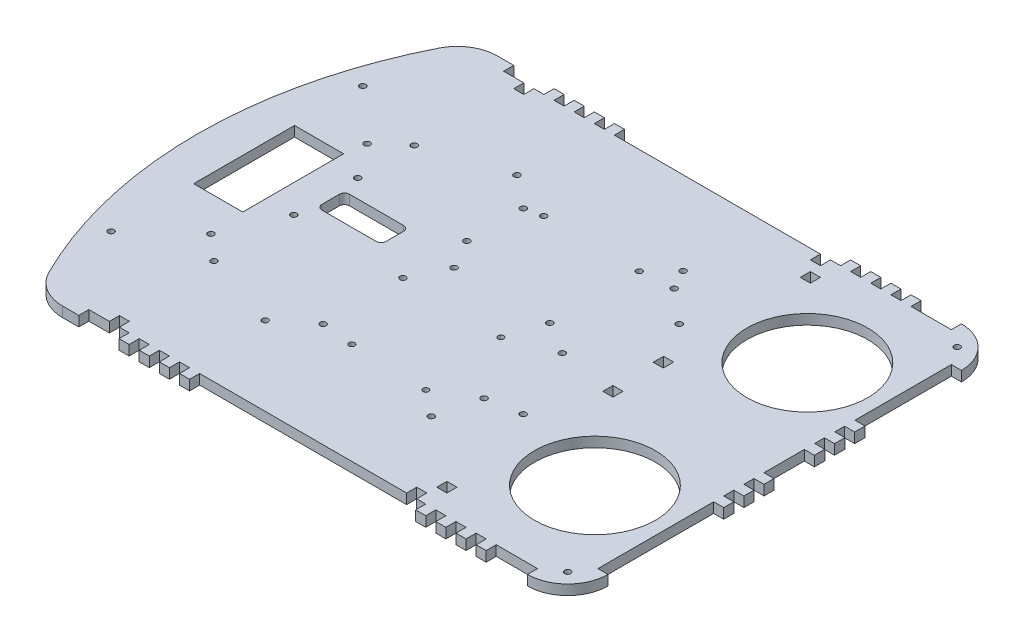
from build123d import *

# Parameters (mm, degrees)
MAIN_BASE_SKETCH_R   = 1.905
MAIN_BASE_SKETCH_R_2 = 1.796
MAIN_BASE_SKETCH_R_3 = 38.1
MAIN_BASE_SKETCH_W   = 6.302603838
MAIN_BASE_SKETCH_H   = 6.555527471
MAIN_BASE_SKETCH_W_2 = 6.35
MAIN_BASE_SKETCH_H_2 = 6.35
MAIN_BASE_SKETCH_W_3 = 30.959086934
MAIN_BASE_SKETCH_H_3 = 63.59667858
MAIN_BASE_DEPTH      = 6.35


with BuildPart() as part:
    # main_base_sketch → main_base (new body)
    with BuildSketch(Plane(origin=(0, 0, 0), x_dir=(1, 0, 0), z_dir=(0, 1, 0))):
        with BuildLine():
            Line((-94.961375831, 124.478458264), (-82.261375831, 124.478458264))
            Line((-82.261375831, 124.478458264), (-82.261375831, 118.128458264))
            Line((-82.261375831, 118.128458264), (-75.911375831, 118.128458264))
            Line((-75.911375831, 118.128458264), (-75.911375831, 124.478458264))
            Line((-75.911375831, 124.478458264), (-69.561375831, 124.478458264))
            Line((-69.561375831, 124.478458264), (-69.561375831, 130.828458264))
            Line((-69.561375831, 130.828458264), (-63.211375831, 130.828458264))
            Line((-63.211375831, 130.828458264), (-63.211375831, 124.478458264))
            Line((-63.211375831, 124.478458264), (-56.861375831, 124.478458264))
            Line((-56.861375831, 124.478458264), (-56.861375831, 130.828458264))
            Line((-56.861375831, 130.828458264), (-50.511375831, 130.828458264))
            Line((-50.511375831, 130.828458264), (-50.511375831, 124.478458264))
            Line((-50.511375831, 124.478458264), (-44.161375831, 124.478458264))
            Line((-44.161375831, 124.478458264), (-44.161375831, 130.828458264))
            Line((-44.161375831, 130.828458264), (-37.811375831, 130.828458264))
            Line((-37.811375831, 130.828458264), (-37.811375831, 124.478458264))
            Line((-37.811375831, 124.478458264), (-31.461375831, 124.478458264))
            Line((-31.461375831, 124.478458264), (-31.461375831, 130.828458264))
            Line((-31.461375831, 130.828458264), (-25.111375831, 130.828458264))
            Line((-25.111375831, 130.828458264), (-25.111375831, 124.478458264))
            Line((-25.111375831, 124.478458264), (104.775, 124.478458264))
            Line((104.775, 124.478458264), (104.775, 118.128458264))
            Line((104.775, 118.128458264), (111.125, 118.128458264))
            Line((111.125, 118.128458264), (111.125, 124.478458264))
            Line((111.125, 124.478458264), (117.475, 124.478458264))
            Line((117.475, 124.478458264), (117.475, 130.828458264))
            Line((117.475, 130.828458264), (123.825, 130.828458264))
            Line((123.825, 130.828458264), (123.825, 124.478458264))
            Line((123.825, 124.478458264), (130.175, 124.478458264))
            Line((130.175, 124.478458264), (130.175, 130.828458264))
            Line((130.175, 130.828458264), (136.525, 130.828458264))
            Line((136.525, 130.828458264), (136.525, 124.478458264))
            Line((136.525, 124.478458264), (142.875, 124.478458264))
            Line((142.875, 124.478458264), (142.875, 130.828458264))
            Line((142.875, 130.828458264), (149.225, 130.828458264))
            Line((149.225, 130.828458264), (149.225, 124.478458264))
            Line((149.225, 124.478458264), (155.575, 124.478458264))
            Line((155.575, 124.478458264), (155.575, 130.828458264))
            Line((155.575, 130.828458264), (161.925, 130.828458264))
            Line((161.925, 130.828458264), (161.925, 124.478458264))
            Line((161.925, 124.478458264), (187.325, 124.478458264))
            Line((187.325, 124.478458264), (187.325, 130.828458264))
            ThreePointArc((187.325, 130.828458264), (205.285512242, 123.388970506), (212.725, 105.428458264))
            Line((212.725, 105.428458264), (206.375, 105.428458264))
            Line((206.375, 105.428458264), (206.375, 44.655527471))
            Line((206.375, 44.655527471), (212.725, 44.655527471))
            Line((212.725, 44.655527471), (212.725, 38.1))
            Line((212.725, 38.1), (206.375, 38.1))
            Line((206.375, 38.1), (206.375, 31.955527471))
            Line((206.375, 31.955527471), (212.725, 31.955527471))
            Line((212.725, 31.955527471), (212.725, 25.4))
            Line((212.725, 25.4), (206.375, 25.4))
            Line((206.375, 25.4), (206.375, 24.179190074))
            Line((206.375, 24.179190074), (206.375, 19.255527471))
            Line((206.375, 19.255527471), (212.725, 19.255527471))
            Line((212.725, 19.255527471), (212.725, 12.7))
            Line((212.725, 12.7), (206.375, 12.7))
            Line((206.375, 12.7), (206.375, -12.7))
            Line((206.375, -12.7), (212.725, -12.7))
            Line((212.725, -12.7), (212.725, -19.05))
            Line((212.725, -19.05), (206.375, -19.05))
            Line((206.375, -19.05), (206.375, -25.4))
            Line((206.375, -25.4), (212.725, -25.4))
            Line((212.725, -25.4), (212.725, -31.75))
            Line((212.725, -31.75), (206.375, -31.75))
            Line((206.375, -31.75), (206.375, -38.1))
            Line((206.375, -38.1), (212.725, -38.1))
            Line((212.725, -38.1), (212.725, -44.45))
            Line((212.725, -44.45), (206.375, -44.45))
            Line((206.375, -44.45), (206.375, -117.410242597))
            Line((206.375, -117.410242597), (212.725, -117.410242597))
            ThreePointArc((212.725, -117.410242597), (205.285512242, -135.370754839), (187.325, -142.810242597))
            Line((187.325, -142.810242597), (187.325, -136.460242597))
            Line((187.325, -136.460242597), (161.284730748, -136.460242597))
            Line((161.284730748, -136.460242597), (161.284730748, -142.810242597))
            Line((161.284730748, -142.810242597), (154.934730748, -142.810242597))
            Line((154.934730748, -142.810242597), (154.934730748, -136.460242597))
            Line((154.934730748, -136.460242597), (148.584730748, -136.460242597))
            Line((148.584730748, -136.460242597), (148.584730748, -142.810242597))
            Line((148.584730748, -142.810242597), (142.234730748, -142.810242597))
            Line((142.234730748, -142.810242597), (142.234730748, -136.460242597))
            Line((142.234730748, -136.460242597), (135.884730748, -136.460242597))
            Line((135.884730748, -136.460242597), (135.884730748, -142.810242597))
            Line((135.884730748, -142.810242597), (129.534730748, -142.810242597))
            Line((129.534730748, -142.810242597), (129.534730748, -136.460242597))
            Line((129.534730748, -136.460242597), (123.184730748, -136.460242597))
            Line((123.184730748, -136.460242597), (123.184730748, -142.810242597))
            Line((123.184730748, -142.810242597), (116.834730748, -142.810242597))
            Line((116.834730748, -142.810242597), (116.834730748, -136.460242597))
            Line((116.834730748, -136.460242597), (111.125, -136.460242597))
            Line((111.125, -136.460242597), (111.125, -130.101785028))
            Line((111.125, -130.101785028), (104.775, -130.101785028))
            Line((104.775, -130.101785028), (104.775, -136.460242597))
            Line((104.775, -136.460242597), (-25.751645083, -136.460242597))
            Line((-25.751645083, -136.460242597), (-25.751645083, -142.810242597))
            Line((-25.751645083, -142.810242597), (-32.101645083, -142.810242597))
            Line((-32.101645083, -142.810242597), (-32.101645083, -136.460242597))
            Line((-32.101645083, -136.460242597), (-38.451645083, -136.460242597))
            Line((-38.451645083, -136.460242597), (-38.451645083, -142.810242597))
            Line((-38.451645083, -142.810242597), (-44.801645083, -142.810242597))
            Line((-44.801645083, -142.810242597), (-44.801645083, -136.460242597))
            Line((-44.801645083, -136.460242597), (-51.151645083, -136.460242597))
            Line((-51.151645083, -136.460242597), (-51.151645083, -142.810242597))
            Line((-51.151645083, -142.810242597), (-57.501645083, -142.810242597))
            Line((-57.501645083, -142.810242597), (-57.501645083, -136.460242597))
            Line((-57.501645083, -136.460242597), (-63.851645083, -136.460242597))
            Line((-63.851645083, -136.460242597), (-63.851645083, -142.810242597))
            Line((-63.851645083, -142.810242597), (-70.201645083, -142.810242597))
            Line((-70.201645083, -142.810242597), (-70.201645083, -136.460242597))
            Line((-70.201645083, -136.460242597), (-76.408932816, -136.460242597))
            Line((-76.408932816, -136.460242597), (-76.408932816, -130.101785028))
            Line((-76.408932816, -130.101785028), (-82.6643, -130.101785028))
            Line((-82.6643, -130.101785028), (-82.6643, -136.460242597))
            Line((-82.6643, -136.460242597), (-95.601645083, -136.460242597))
            Line((-95.601645083, -136.460242597), (-95.601645083, -142.810242597))
            Line((-95.601645083, -142.810242597), (-105.798207048, -142.810242597))
            ThreePointArc((-105.798207048, -142.810242597), (-119.167015715, -139.007347839), (-128.532661201, -128.737404395))
            ThreePointArc((-128.532661201, -128.737404395), (-157.286213724, -5.861503432), (-127.918775374, 116.869125935))
            ThreePointArc((-127.918775374, 116.869125935), (-118.556014486, 127.058910858), (-105.241228699, 130.828458264))
            Line((-105.241228699, 130.828458264), (-94.961375831, 130.828458264))
            Line((-94.961375831, 130.828458264), (-94.961375831, 124.478458264))
        make_face()
        with Locations((-82.6643, 55.745700743)):
            Circle(MAIN_BASE_SKETCH_R, mode=Mode.SUBTRACT)
        with Locations((-13.8303, 55.745700743)):
            Circle(MAIN_BASE_SKETCH_R, mode=Mode.SUBTRACT)
        with Locations((-3.2843, 57.993600743)):
            Circle(MAIN_BASE_SKETCH_R, mode=Mode.SUBTRACT)
        with Locations((-13.8303, 20.1549)):
            Circle(MAIN_BASE_SKETCH_R, mode=Mode.SUBTRACT)
        with Locations((-3.2843, 1.529400743)):
            Circle(MAIN_BASE_SKETCH_R, mode=Mode.SUBTRACT)
        with Locations((-82.6643, 20.1549)):
            Circle(MAIN_BASE_SKETCH_R, mode=Mode.SUBTRACT)
        with Locations((-82.6643, -20.1549)):
            Circle(MAIN_BASE_SKETCH_R, mode=Mode.SUBTRACT)
        with Locations((-13.8303, -20.1549)):
            Circle(MAIN_BASE_SKETCH_R, mode=Mode.SUBTRACT)
        with Locations((-82.6643, -70.568499257)):
            Circle(MAIN_BASE_SKETCH_R, mode=Mode.SUBTRACT)
        with Locations((-13.8303, -70.568499257)):
            Circle(MAIN_BASE_SKETCH_R, mode=Mode.SUBTRACT)
        with Locations((6.29, -72.547599257)):
            Circle(MAIN_BASE_SKETCH_R_2, mode=Mode.SUBTRACT)
        with Locations((54.55, -74.135099257)):
            Circle(MAIN_BASE_SKETCH_R_2, mode=Mode.SUBTRACT)
        with Locations((49.47, -21.747599257)):
            Circle(MAIN_BASE_SKETCH_R_2, mode=Mode.SUBTRACT)
        with Locations((57.0407, 1.529400743)):
            Circle(MAIN_BASE_SKETCH_R, mode=Mode.SUBTRACT)
        with Locations((57.0407, 57.993600743)):
            Circle(MAIN_BASE_SKETCH_R, mode=Mode.SUBTRACT)
        with Locations((-98.425, 41.822400743)):
            Circle(MAIN_BASE_SKETCH_R, mode=Mode.SUBTRACT)
        with Locations((-34.0871, 71.963600743)):
            Circle(MAIN_BASE_SKETCH_R, mode=Mode.SUBTRACT)
        with Locations((70.6863, 71.963600743)):
            Circle(MAIN_BASE_SKETCH_R, mode=Mode.SUBTRACT)
        with Locations((98.425, 41.822400743)):
            Circle(MAIN_BASE_SKETCH_R, mode=Mode.SUBTRACT)
        with Locations((98.425, -56.645199257)):
            Circle(MAIN_BASE_SKETCH_R, mode=Mode.SUBTRACT)
        with Locations((70.6863, -86.786399257)):
            Circle(MAIN_BASE_SKETCH_R, mode=Mode.SUBTRACT)
        with Locations((-34.0871, -86.786399257)):
            Circle(MAIN_BASE_SKETCH_R, mode=Mode.SUBTRACT)
        with Locations((-98.425, -56.645199257)):
            Circle(MAIN_BASE_SKETCH_R, mode=Mode.SUBTRACT)
        with Locations((77.47, -60.325)):
            Circle(MAIN_BASE_SKETCH_R, mode=Mode.SUBTRACT)
        with Locations((77.47, 59.53125)):
            Circle(MAIN_BASE_SKETCH_R, mode=Mode.SUBTRACT)
        with Locations((77.47, -10.95375)):
            Circle(MAIN_BASE_SKETCH_R, mode=Mode.SUBTRACT)
        with Locations((160.02, 60.978458264)):
            Circle(MAIN_BASE_SKETCH_R_3, mode=Mode.SUBTRACT)
        with Locations((160.02, -72.960242597)):
            Circle(MAIN_BASE_SKETCH_R_3, mode=Mode.SUBTRACT)
        with Locations((-131.296368682, 71.963600743)):
            Circle(MAIN_BASE_SKETCH_R, mode=Mode.SUBTRACT)
        with Locations((-131.296368682, -86.786399257)):
            Circle(MAIN_BASE_SKETCH_R, mode=Mode.SUBTRACT)
        with Locations((198.617679728, 116.869125935)):
            Circle(MAIN_BASE_SKETCH_R, mode=Mode.SUBTRACT)
        with Locations((198.617679728, -128.737404395)):
            Circle(MAIN_BASE_SKETCH_R, mode=Mode.SUBTRACT)
        with Locations((114.276301919, 15.977763736)):
            Rectangle(MAIN_BASE_SKETCH_W, MAIN_BASE_SKETCH_H, mode=Mode.SUBTRACT)
        with BuildLine():
            Line((-42.259046148, -8.681650359), (-76.408932816, -8.681650359))
            ThreePointArc((-76.408932816, -8.681650359), (-78.653996846, -7.751714389), (-79.583932816, -5.506650359))
            Line((-79.583932816, -5.506650359), (-79.583932816, 5.506650359))
            ThreePointArc((-79.583932816, 5.506650359), (-78.653996846, 7.751714389), (-76.408932816, 8.681650359))
            Line((-76.408932816, 8.681650359), (-42.259046148, 8.681650359))
            ThreePointArc((-42.259046148, 8.681650359), (-40.013982118, 7.751714389), (-39.084046148, 5.506650359))
            Line((-39.084046148, 5.506650359), (-39.084046148, -5.506650359))
            ThreePointArc((-39.084046148, -5.506650359), (-40.013982118, -7.751714389), (-42.259046148, -8.681650359))
        make_face(mode=Mode.SUBTRACT)
        with Locations((114.3, -15.875)):
            Rectangle(MAIN_BASE_SKETCH_W_2, MAIN_BASE_SKETCH_H_2, mode=Mode.SUBTRACT)
        with Locations((114.3, 108.603458264)):
            Rectangle(MAIN_BASE_SKETCH_W_2, MAIN_BASE_SKETCH_H_2, mode=Mode.SUBTRACT)
        with Locations((114.3, -120.585242597)):
            Rectangle(MAIN_BASE_SKETCH_W_2, MAIN_BASE_SKETCH_H_2, mode=Mode.SUBTRACT)
        with Locations((-115.816825215, -2.890758117)):
            Rectangle(MAIN_BASE_SKETCH_W_3, MAIN_BASE_SKETCH_H_3, mode=Mode.SUBTRACT)
    extrude(amount=MAIN_BASE_DEPTH)


solid = part.part
